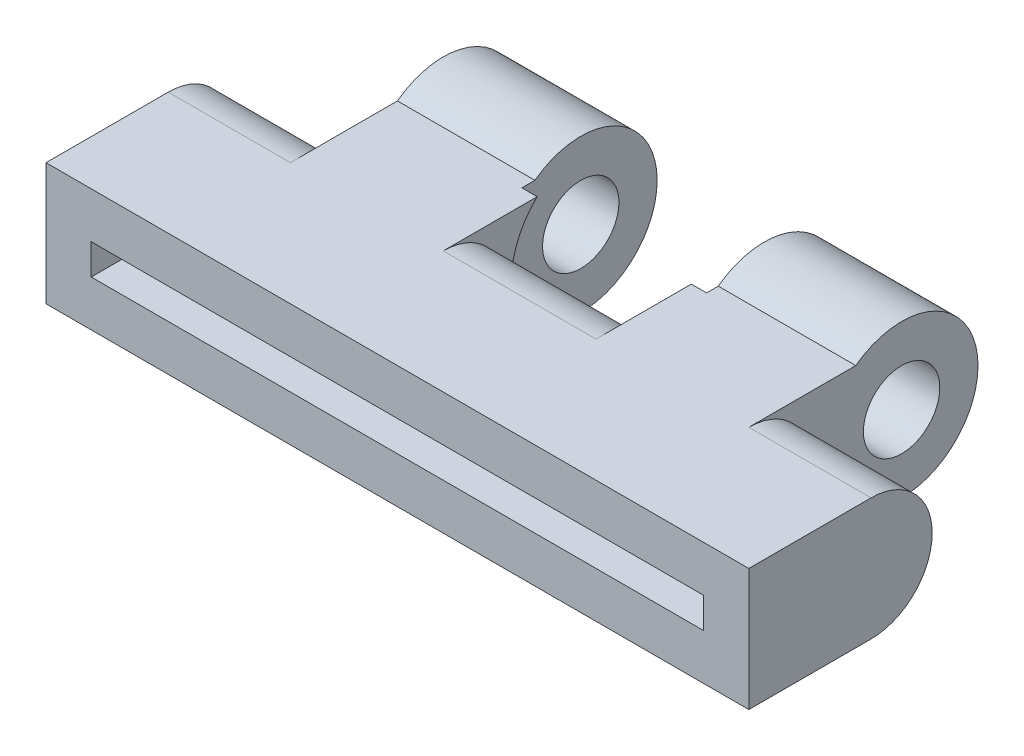
from build123d import *

# Parameters (mm, degrees)
SKETCH2_W            = 230
SKETCH2_H            = 40
BOSS_EXTRUDE1_DEPTH  = 80
SKETCH3_W            = 200.4
SKETCH3_H            = 10
CUT_EXTRUDE1_DEPTH   = 30
SKETCH6_R            = 25
BOSS_EXTRUDE3_DEPTH  = 50
SKETCH7_R            = 12.5
CUT_EXTRUDE2_DEPTH   = 50
SKETCH8_R            = 26.5
CUT_EXTRUDE3_DEPTH   = 25
CUT_EXTRUDE4_START   = 40
SKETCH11_R           = 26.5
CUT_EXTRUDE4_DEPTH   = 40
SKETCH14_W           = 12.614661349
SKETCH14_H           = 40
CUT_EXTRUDE6_DEPTH   = 50
FILLET3_R            = 20
FILLET3_OF_MIRROR5_R = 20
FILLET3_OF_MIRROR8_R = 20
SKETCH15_R           = 27.771194789
CUT_EXTRUDE7_DEPTH   = 5
SKETCH21_R           = 27.635802496
CUT_EXTRUDE8_DEPTH   = 5


with BuildPart() as part:
    # Sketch2 → Boss-Extrude1 (new body)
    with BuildSketch(Plane.XY):
        with Locations((115, 20)):
            Rectangle(SKETCH2_W, SKETCH2_H)
    extrude(amount=BOSS_EXTRUDE1_DEPTH)

    # Sketch3 → Cut-Extrude1 (cut)
    with BuildSketch(Plane.XY.offset(80)):
        with Locations((115, 20)):
            Rectangle(SKETCH3_W, SKETCH3_H)
    extrude(amount=-CUT_EXTRUDE1_DEPTH, mode=Mode.SUBTRACT)

    # Sketch6 → Boss-Extrude3 (add)
    with BuildSketch(Plane(origin=(140, 0, 0), x_dir=(0, 0, -1), z_dir=(1, 0, 0))):
        with Locations((10, 20)):
            Circle(SKETCH6_R)
    boss_extrude3 = extrude(amount=BOSS_EXTRUDE3_DEPTH)

    # Sketch7 → Cut-Extrude2 (cut)
    with BuildSketch(Plane.ZY.offset(-140)):
        with Locations(Location((-10, 20, 0), (0, 0, 36.869897646))):
            Circle(SKETCH7_R)
    cut_extrude2 = extrude(amount=-CUT_EXTRUDE2_DEPTH, mode=Mode.SUBTRACT)

    # Sketch8 → Cut-Extrude3 (cut)
    with BuildSketch(Plane.ZY.offset(-140)):
        with Locations((-10, 20)):
            Circle(SKETCH8_R)
    cut_extrude3 = extrude(amount=CUT_EXTRUDE3_DEPTH, mode=Mode.SUBTRACT)

    # Sketch11 → Cut-Extrude4 (cut)
    with BuildSketch(Plane(origin=(190, 0, 0), x_dir=(0, 0, -1), z_dir=(1, 0, 0)).offset(CUT_EXTRUDE4_START)):
        with Locations((10, 20)):
            Circle(SKETCH11_R)
    cut_extrude4 = extrude(amount=-CUT_EXTRUDE4_DEPTH, mode=Mode.SUBTRACT)

    # Mirror1: Boss-Extrude3, Cut-Extrude2, Cut-Extrude3, Cut-Extrude4 across plane
    add(boss_extrude3.mirror(Plane(origin=(115, 0, 0), x_dir=(0, 0, 1), z_dir=(1, 0, 0))))
    add(cut_extrude2.mirror(Plane(origin=(115, 0, 0), x_dir=(0, 0, 1), z_dir=(1, 0, 0))), mode=Mode.SUBTRACT)
    add(cut_extrude3.mirror(Plane(origin=(115, 0, 0), x_dir=(0, 0, 1), z_dir=(1, 0, 0))), mode=Mode.SUBTRACT)
    add(cut_extrude4.mirror(Plane(origin=(115, 0, 0), x_dir=(0, 0, 1), z_dir=(1, 0, 0))), mode=Mode.SUBTRACT)

    # Sketch14 → Cut-Extrude6 (cut)
    with BuildSketch(Plane(origin=(90, 0, 0), x_dir=(0, 0, -1), z_dir=(1, 0, 0))):
        with Locations((-13.692669326, 20)):
            Rectangle(SKETCH14_W, SKETCH14_H)
    cut_extrude6 = extrude(amount=CUT_EXTRUDE6_DEPTH, mode=Mode.SUBTRACT)

    # Fillet3
    fillet3_edges = [part.edges().sort_by_distance(p)[0] for p in [
        (115, 40, 20),
        (115, 0, 20),
    ]]
    fillet(fillet3_edges, radius=FILLET3_R - 0.0001)  # a hair under: the kernel refuses the full size

    # Mirror5: Cut-Extrude6 across plane
    add(cut_extrude6.mirror(Plane.ZY.offset(-165)), mode=Mode.SUBTRACT)

    # Fillet3 of Mirror5
    fillet3_of_mirror5_edges = [part.edges().sort_by_distance(p)[0] for p in [
        (210, 40, 20),
        (210, 0, 20),
    ]]
    fillet(fillet3_of_mirror5_edges, radius=FILLET3_OF_MIRROR5_R - 0.0001)  # a hair under: the kernel refuses the full size

    # Mirror8: Cut-Extrude6 across plane
    add(cut_extrude6.mirror(Plane(origin=(65, 0, 0), x_dir=(0, 0, 1), z_dir=(1, 0, 0))), mode=Mode.SUBTRACT)

    # Fillet3 of Mirror8
    fillet3_of_mirror8_edges = [part.edges().sort_by_distance(p)[0] for p in [
        (20, 40, 20),
        (20, 0, 20),
    ]]
    fillet(fillet3_of_mirror8_edges, radius=FILLET3_OF_MIRROR8_R - 0.0001)  # a hair under: the kernel refuses the full size

    # Sketch15 → Cut-Extrude7 (cut)
    with BuildSketch(Plane(origin=(90, 0, 0), x_dir=(0, 0, -1), z_dir=(1, 0, 0))):
        with Locations((10, 20)):
            Circle(SKETCH15_R)
    extrude(amount=-CUT_EXTRUDE7_DEPTH, mode=Mode.SUBTRACT)

    # Sketch21 → Cut-Extrude8 (cut)
    with BuildSketch(Plane.ZY.offset(-140)):
        with Locations((-10.3298846, 20.067055547)):
            Circle(SKETCH21_R)
    extrude(amount=-CUT_EXTRUDE8_DEPTH, mode=Mode.SUBTRACT)


solid = part.part
